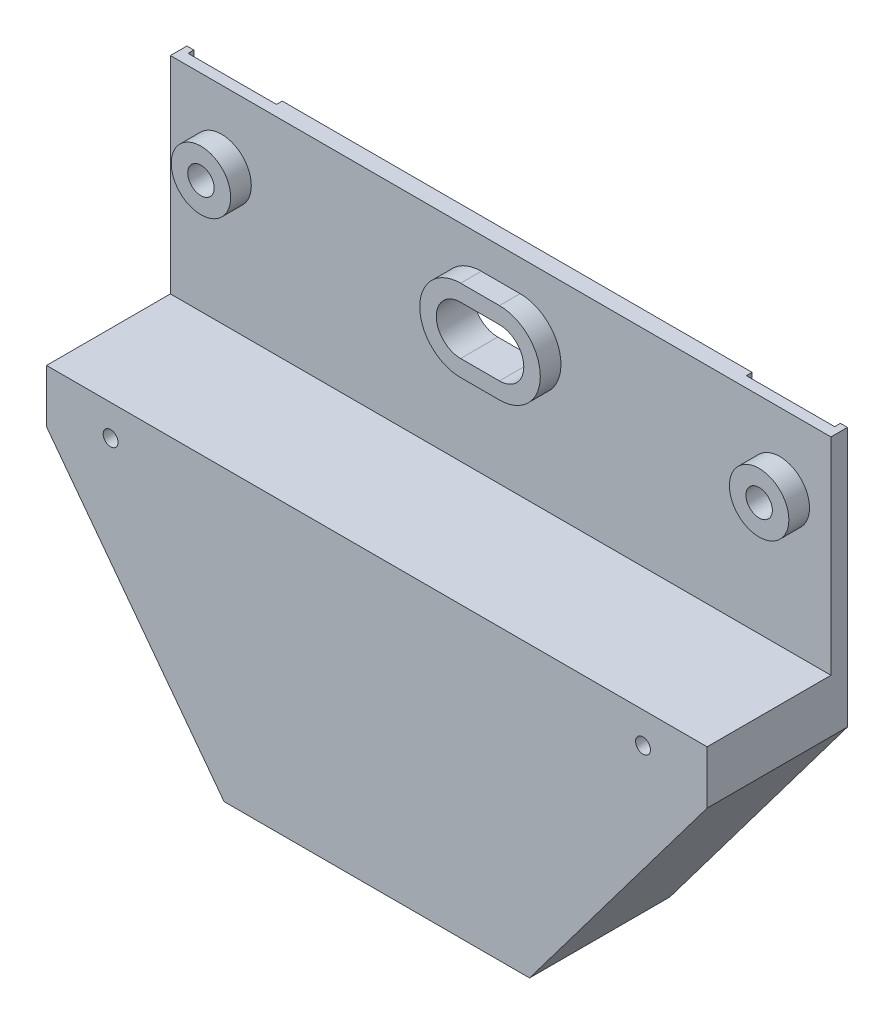
from build123d import *

# Parameters (mm, degrees)
BASE_FLANGE1_DEPTH           = 5.08
OG_POCKET_DEPTH              = 38.1
SHELL_OF_POCKET_DEPTH        = 38.1
BATTERY_TAIL_HOLE_DEPTH      = 189.182975851
BATTERY_TAIL_HOLE_DEPTH_BACK = 189.182975851
SKETCH11_R                   = 4.064
TAB_BOLT_HOLES_DEPTH         = 189.182975851
SKETCH12_W                   = 30.48
SKETCH12_H                   = 12.716912384
WEIGHT_SAVER_DEPTH           = 10.16
SKETCH13_R                   = 2.286
BOLT_HOLES_THROUGH_DEPTH     = 189.182975851
CUT_EXTRUDE6_DEPTH           = 1.778
POSSIBLE_LIP_R               = 9.144
POSSIBLE_LIP_R_2             = 4.064
BATTERY_LIP_DEPTH            = 6.35


# Sheet-metal steps are written as plain solids
with BuildPart() as part:
    # Sketch1 → Base-Flange1 (new body)
    with BuildSketch(Plane.XY):
        Polygon((0, 0), (46.99, 0), (101.6, 72.558989745), (101.6, 152.4), (-101.6, 152.4), (-101.6, 72.558989745), (-46.99, 0), align=None)
    extrude(amount=-BASE_FLANGE1_DEPTH)

    # Sketch6 → OG Pocket (add)
    with BuildSketch(Plane.XY):
        Polygon((-101.6, 72.558989745), (-101.6, 88.9), (101.6, 88.9), (101.6, 72.558989745), (46.99, 0), (-46.99, 0), align=None)
    extrude(amount=OG_POCKET_DEPTH)

    # Sketch9 → Shell of Pocket (cut)
    with BuildSketch(Plane(origin=(0, 0, -5.08), x_dir=(-1, 0, 0), z_dir=(0, 0, -1))):
        Polygon((-76.889615099, 44.589315736), (-76.889615099, 85.725), (76.889615099, 85.725), (76.889615099, 44.589315736), (45.72, 3.175), (-45.72, 3.175), align=None)
    extrude(amount=-SHELL_OF_POCKET_DEPTH, mode=Mode.SUBTRACT)

    # Sketch10 → Battery Tail Hole (cut, two sides: drawn at the far end of the back side and taken through both)
    with BuildSketch(Plane(origin=(0, 0, -5.08), x_dir=(-1, 0, 0), z_dir=(0, 0, -1)).offset(-BATTERY_TAIL_HOLE_DEPTH_BACK)):
        with BuildLine():
            Line((-5.969, 137.668), (5.969, 137.668))
            ThreePointArc((5.969, 137.668), (13.462, 130.175), (5.969, 122.682))
            Line((5.969, 122.682), (-5.969, 122.682))
            ThreePointArc((-5.969, 122.682), (-13.462, 130.175), (-5.969, 137.668))
        make_face()
    extrude(amount=BATTERY_TAIL_HOLE_DEPTH + BATTERY_TAIL_HOLE_DEPTH_BACK, mode=Mode.SUBTRACT)

    # Sketch11 → Tab Bolt Holes (cut, through all)
    with BuildSketch(Plane(origin=(0, 0, -5.08), x_dir=(-1, 0, 0), z_dir=(0, 0, -1))):
        with Locations((-85.852, 130.175)):
            Circle(SKETCH11_R)
        with Locations((85.852, 130.175)):
            Circle(SKETCH11_R)
    extrude(amount=-TAB_BOLT_HOLES_DEPTH, mode=Mode.SUBTRACT)

    # Sketch12 → Weight Saver (cut)
    with BuildSketch(Plane.ZY.offset(-76.889615099)):
        with Locations((17.78, 79.366543808)):
            Rectangle(SKETCH12_W, SKETCH12_H)
    weight_saver = extrude(amount=-WEIGHT_SAVER_DEPTH, mode=Mode.SUBTRACT)

    # Mirror1: Weight Saver across plane
    add(weight_saver.mirror(Plane(origin=(0, 0, 0), x_dir=(0, 0, 1), z_dir=(1, 0, 0))), mode=Mode.SUBTRACT)

    # Sketch13 → Bolt holes- Through (cut, symmetric)
    with BuildSketch(Plane(origin=(0, 0, -5.08), x_dir=(-1, 0, 0), z_dir=(0, 0, -1))):
        with Locations(Location((-81.885444711, 79.366543808, 0), (0, 0, 90))):
            Circle(SKETCH13_R)
    bolt_holes_through = extrude(amount=BOLT_HOLES_THROUGH_DEPTH, both=True, mode=Mode.SUBTRACT)

    # Mirror2: Bolt holes- Through across plane
    add(bolt_holes_through.mirror(Plane(origin=(0, 0, 0), x_dir=(0, 0, 1), z_dir=(1, 0, 0))), mode=Mode.SUBTRACT)

    # Sketch14 → Cut-Extrude6 (cut)
    with BuildSketch(Plane(origin=(0, 0, -5.08), x_dir=(-1, 0, 0), z_dir=(0, 0, -1))):
        with BuildLine():
            Line((72.263, 152.4), (72.263, 130.175))
            ThreePointArc((72.263, 130.175), (85.852, 116.586), (99.441, 130.175))
            Line((99.441, 130.175), (99.441, 152.4))
            Line((99.441, 152.4), (72.263, 152.4))
        make_face()
    cut_extrude6 = extrude(amount=-CUT_EXTRUDE6_DEPTH, mode=Mode.SUBTRACT)

    # Mirror3: Cut-Extrude6 across plane
    add(cut_extrude6.mirror(Plane(origin=(0, 0, 0), x_dir=(0, 0, 1), z_dir=(1, 0, 0))), mode=Mode.SUBTRACT)

    # Possible Lip → Battery Lip (add)
    # profile 1 of 3: a face of its own
    with BuildSketch(Plane.XY):
        with Locations((85.852, 130.175)):
            Circle(POSSIBLE_LIP_R)
        with Locations(Location((85.852, 130.175, 0), (0, 0, 180))):
            Circle(POSSIBLE_LIP_R_2, mode=Mode.SUBTRACT)
    # profile 2 of 3: a face of its own
    with BuildSketch(Plane.XY):
        with Locations((-85.852, 130.175)):
            Circle(POSSIBLE_LIP_R)
        with Locations(Location((-85.852, 130.175, 0), (0, 0, 180))):
            Circle(POSSIBLE_LIP_R_2, mode=Mode.SUBTRACT)
    # profile 3 of 3: a face of its own
    with BuildSketch(Plane.XY):
        with BuildLine():
            Line((-5.969, 117.602), (5.969, 117.602))
            ThreePointArc((5.969, 117.602), (18.542, 130.175), (5.969, 142.748))
            Line((5.969, 142.748), (-5.969, 142.748))
            ThreePointArc((-5.969, 142.748), (-18.542, 130.175), (-5.969, 117.602))
        make_face()
        with BuildLine():
            Line((-5.969, 122.682), (5.969, 122.682))
            ThreePointArc((5.969, 122.682), (13.462, 130.175), (5.969, 137.668))
            Line((5.969, 137.668), (-5.969, 137.668))
            ThreePointArc((-5.969, 137.668), (-13.462, 130.175), (-5.969, 122.682))
        make_face(mode=Mode.SUBTRACT)
    extrude(amount=BATTERY_LIP_DEPTH)


solid = part.part
